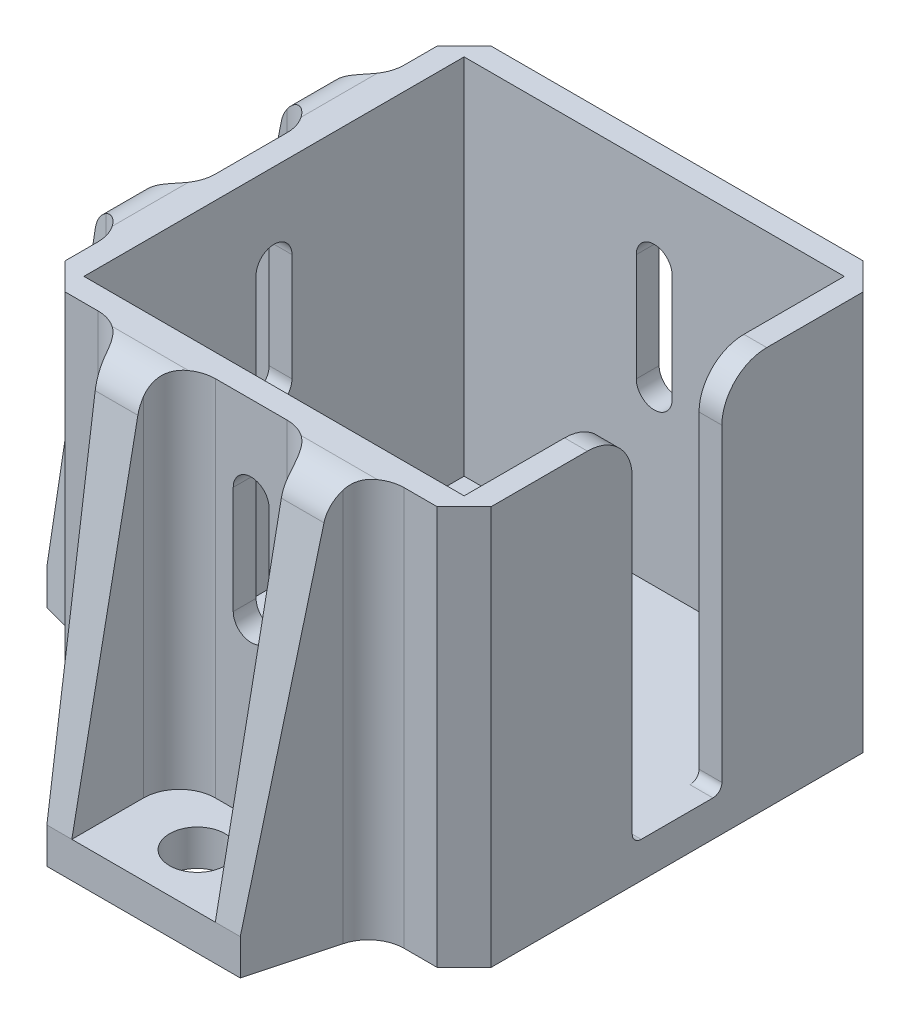
from build123d import *

# Parameters (mm, degrees)
SKETCH1_W                = 47.5
SKETCH1_H                = 47.5
SKETCH1_W_2              = 42.4
SKETCH1_H_2              = 42.4
BOSS_EXTRUDE1_DEPTH      = 40.5
FILLET1_SIZE             = 3
BOSS_EXTRUDE3_DEPTH      = 10
BOSS_EXTRUDE3_DEPTH_BACK = 10
CUT_EXTRUDE1_DEPTH       = 8
CUT_EXTRUDE1_DEPTH_BACK  = 8
BOSS_EXTRUDE4_DEPTH      = 10
BOSS_EXTRUDE4_DEPTH_BACK = 10
CUT_EXTRUDE2_DEPTH       = 8
CUT_EXTRUDE2_DEPTH_BACK  = 8
BOSS_EXTRUDE6_DEPTH      = 4
SKETCH10_R               = 3.1
CUT_EXTRUDE3_DEPTH       = 65.779433465
SKETCH11_R               = 3.1
CUT_EXTRUDE4_DEPTH       = 65.779433465
SKETCH14_W               = 5
SKETCH14_H               = 40.5
CUT_EXTRUDE6_DEPTH       = 10
FILLET9_R                = 5
FILLET10_R               = 1
CUT_EXTRUDE7_DEPTH       = 2.55
CUT_EXTRUDE8_DEPTH       = 72.93443195
CHAMFER1_SIZE            = 4
CHAMFER1_SIZE_2          = 14.92820323
CHAMFER2_SIZE            = 4
CHAMFER2_SIZE_2          = 14.92820323
CHAMFER3_SIZE            = 4
CHAMFER3_SIZE_2          = 14.92820323
FILLET16_R               = 4
FILLET17_R               = 4


with BuildPart() as part:
    # Sketch1 → Boss-Extrude1 (new body)
    with BuildSketch(Plane(origin=(0, 0, 0), x_dir=(1, 0, 0), z_dir=(0, 1, 0))):
        Rectangle(SKETCH1_W, SKETCH1_H)
        Rectangle(SKETCH1_W_2, SKETCH1_H_2, mode=Mode.SUBTRACT)
    extrude(amount=BOSS_EXTRUDE1_DEPTH)

    # Fillet1
    fillet1_edges = [part.edges().sort_by_distance(p)[0] for p in [
        (23.75, 20.25, 23.75),
        (-23.75, 20.25, 23.75),
        (-23.75, 20.25, -23.75),
        (23.75, 20.25, -23.75),
    ]]
    chamfer(fillet1_edges, length=FILLET1_SIZE)

    # Sketch3 → Boss-Extrude3 (add, two sides: drawn at the far end of the back side and taken through both)
    with BuildSketch(Plane.XY.offset(-BOSS_EXTRUDE3_DEPTH_BACK)):
        Polygon((-23.75, 0), (-23.75, 40.5), (-27.75, 40.5), (-35.75, 0), align=None)
    extrude(amount=BOSS_EXTRUDE3_DEPTH + BOSS_EXTRUDE3_DEPTH_BACK)

    # Sketch4 → Cut-Extrude1 (cut, two sides: drawn at the far end of the back side and taken through both)
    with BuildSketch(Plane.XY.offset(-CUT_EXTRUDE1_DEPTH_BACK)):
        Polygon((-35.75, 0), (-23.75, 0), (-23.75, 40.5), (-27.75, 40.5), align=None)
    extrude(amount=CUT_EXTRUDE1_DEPTH + CUT_EXTRUDE1_DEPTH_BACK, mode=Mode.SUBTRACT)

    # Sketch7 → Boss-Extrude4 (add, two sides: drawn at the far end of the back side and taken through both)
    with BuildSketch(Plane(origin=(0, 0, 0), x_dir=(0, 0, -1), z_dir=(1, 0, 0)).offset(-BOSS_EXTRUDE4_DEPTH_BACK)):
        Polygon((-35.75, 0), (-23.75, 0), (-23.75, 40.5), (-27.75, 40.5), align=None)
    extrude(amount=BOSS_EXTRUDE4_DEPTH + BOSS_EXTRUDE4_DEPTH_BACK)

    # Sketch8 → Cut-Extrude2 (cut, two sides: drawn at the far end of the back side and taken through both)
    with BuildSketch(Plane(origin=(0, 0, 0), x_dir=(0, 0, -1), z_dir=(1, 0, 0)).offset(-CUT_EXTRUDE2_DEPTH_BACK)):
        Polygon((-23.75, 0), (-23.75, 40.5), (-27.75, 40.5), (-35.75, 0), align=None)
    extrude(amount=CUT_EXTRUDE2_DEPTH + CUT_EXTRUDE2_DEPTH_BACK, mode=Mode.SUBTRACT)

    # Sketch9 → Boss-Extrude6 (add)
    with BuildSketch(Plane(origin=(0, 0, 0), x_dir=(1, 0, 0), z_dir=(0, 1, 0))):
        Polygon((-35.75, -10), (-23.75, -10), (-23.75, -20.75), (-20.75, -23.75), (-10, -23.75), (-10, -35.75), (10, -35.75), (10, -23.75), (20.75, -23.75), (23.75, -20.75), (23.75, 20.75), (20.75, 23.75), (-20.75, 23.75), (-23.75, 20.75), (-23.75, 10), (-35.75, 10), align=None)
    extrude(amount=-BOSS_EXTRUDE6_DEPTH)

    # Sketch10 → Cut-Extrude3 (cut, through all)
    with BuildSketch(Plane(origin=(0, 0, 0), x_dir=(1, 0, 0), z_dir=(0, 1, 0))):
        with Locations(Location((-29.75, 0, 0), (0, 0, 270))):
            Circle(SKETCH10_R)
    extrude(amount=-CUT_EXTRUDE3_DEPTH, mode=Mode.SUBTRACT)

    # Sketch11 → Cut-Extrude4 (cut, through all)
    with BuildSketch(Plane(origin=(0, 0, 0), x_dir=(1, 0, 0), z_dir=(0, 1, 0))):
        with Locations(Location((0, -29.75, 0), (0, 0, 270))):
            Circle(SKETCH11_R)
    extrude(amount=-CUT_EXTRUDE4_DEPTH, mode=Mode.SUBTRACT)

    # Sketch14 → Cut-Extrude6 (cut)
    with BuildSketch(Plane(origin=(23.75, 0, 0), x_dir=(0, 0, -1), z_dir=(1, 0, 0))):
        with Locations((-2.5, 20.25)):
            Rectangle(SKETCH14_W, SKETCH14_H)
        with Locations((2.5, 20.25)):
            Rectangle(SKETCH14_W, SKETCH14_H)
    extrude(amount=-CUT_EXTRUDE6_DEPTH, mode=Mode.SUBTRACT)

    # Fillet9
    fillet9_edges = [part.edges().sort_by_distance(p)[0] for p in [
        (22.475, 40.5, 5),
        (22.475, 40.5, -5),
    ]]
    fillet(fillet9_edges, radius=FILLET9_R)

    # Fillet10
    fillet10_edges = [part.edges().sort_by_distance(p)[0] for p in [
        (22.475, 0, -5),
        (22.475, 0, 5),
    ]]
    fillet(fillet10_edges, radius=FILLET10_R)

    # Sketch15 → Cut-Extrude7 (cut)
    with BuildSketch(Plane.ZY.offset(23.75)):
        with BuildLine():
            Line((-2, 19), (-2, 31))
            ThreePointArc((-2, 31), (0, 33), (2, 31))
            Line((2, 31), (2, 19))
            ThreePointArc((2, 19), (0, 17), (-2, 19))
        make_face()
    extrude(amount=-CUT_EXTRUDE7_DEPTH, mode=Mode.SUBTRACT)

    # Sketch16 → Cut-Extrude8 (cut, through all)
    with BuildSketch(Plane.XY.offset(23.75)):
        with BuildLine():
            Line((2, 31), (2, 19))
            ThreePointArc((2, 19), (0, 17), (-2, 19))
            Line((-2, 19), (-2, 31))
            ThreePointArc((-2, 31), (0, 33), (2, 31))
        make_face()
    extrude(amount=-CUT_EXTRUDE8_DEPTH, mode=Mode.SUBTRACT)

    # Chamfer1
    # the kernel refuses this chamfer: 14.92820323, 4 mm, written as the material it adds along each edge
    with BuildSketch(Plane(origin=(10, 40.5, 23.75), x_dir=(0.9905000388259542, 0, -0.13751244702129095), z_dir=(0, -1, 0))) as chamfer1_piece_1_section:
        Polygon((CHAMFER1_SIZE * 0.990500038826, CHAMFER1_SIZE * 0.137512447021), (-CHAMFER1_SIZE_2 * 0.137512447024, CHAMFER1_SIZE_2 * 0.990500038844), (0, 0), align=None)
    chamfer1_piece_1 = extrude(amount=44.5, mode=Mode.PRIVATE)
    chamfer1_piece_1 = split(chamfer1_piece_1, bisect_by=Plane(origin=(11.413878062, 16.831768276, 32.425206267), z_dir=(0, -0.19378641821299017, -0.9810437422032618)), keep=Keep.TOP, mode=Mode.PRIVATE)
    chamfer1_piece_1 = split(chamfer1_piece_1, bisect_by=Plane(origin=(11.413878062, 15.820324331, 35.75), z_dir=(0, 0, -1)), keep=Keep.TOP, mode=Mode.PRIVATE)
    add(chamfer1_piece_1)
    with BuildSketch(Plane(origin=(-23.75, 40.5, 10), x_dir=(-0.9999503267608394, 0, -0.009967146577156315), z_dir=(0, -1, 0))) as chamfer1_piece_2_section:
        Polygon((CHAMFER1_SIZE_2 * 0.999950326779, -CHAMFER1_SIZE_2 * 0.00996714657734), (-CHAMFER1_SIZE * 0.00996714657716, -CHAMFER1_SIZE * 0.999950326761), (0, 0), align=None)
    chamfer1_piece_2 = extrude(amount=44.5, mode=Mode.PRIVATE)
    chamfer1_piece_2 = split(chamfer1_piece_2, bisect_by=Plane(origin=(-32.425206267, 16.831768276, 11.413878062), z_dir=(0.9810437422032618, -0.19378641821299017, 0)), keep=Keep.TOP, mode=Mode.PRIVATE)
    chamfer1_piece_2 = split(chamfer1_piece_2, bisect_by=Plane(origin=(-35.75, 15.820324331, 11.413878062), z_dir=(1, 0, 0)), keep=Keep.TOP, mode=Mode.PRIVATE)
    add(chamfer1_piece_2)

    # Chamfer2
    # the kernel refuses this chamfer: 14.92820323, 4 mm, written as the material it adds along each edge
    with BuildSketch(Plane(origin=(-23.75, 40.5, -10), x_dir=(0.13751244702129095, 0, -0.9905000388259542), z_dir=(0, -1, 0))) as chamfer2_piece_1_section:
        Polygon((CHAMFER2_SIZE * 0.990500038826, -CHAMFER2_SIZE * 0.137512447021), (-CHAMFER2_SIZE_2 * 0.137512447024, -CHAMFER2_SIZE_2 * 0.990500038844), (0, 0), align=None)
    chamfer2_piece_1 = extrude(amount=44.5, mode=Mode.PRIVATE)
    chamfer2_piece_1 = split(chamfer2_piece_1, bisect_by=Plane(origin=(-32.425206267, 16.831768276, -11.413878062), z_dir=(0.9810437422032618, -0.19378641821299017, 0)), keep=Keep.TOP, mode=Mode.PRIVATE)
    chamfer2_piece_1 = split(chamfer2_piece_1, bisect_by=Plane(origin=(-35.75, 15.820324331, -11.413878062), z_dir=(1, 0, 0)), keep=Keep.TOP, mode=Mode.PRIVATE)
    add(chamfer2_piece_1)

    # Chamfer3
    # the kernel refuses this chamfer: 14.92820323, 4 mm, written as the material it adds along each edge
    with BuildSketch(Plane(origin=(-10, -4, 23.75), x_dir=(-0.9905000388259542, 0, -0.13751244702129095), z_dir=(0, 1, 0))) as chamfer3_piece_1_section:
        Polygon((CHAMFER3_SIZE * 0.990500038826, CHAMFER3_SIZE * 0.137512447021), (-CHAMFER3_SIZE_2 * 0.137512447024, CHAMFER3_SIZE_2 * 0.990500038844), (0, 0), align=None)
    chamfer3_piece_1 = extrude(amount=44.5, mode=Mode.PRIVATE)
    chamfer3_piece_1 = split(chamfer3_piece_1, bisect_by=Plane(origin=(-11.413878062, 16.831768276, 32.425206267), z_dir=(0, -0.19378641821299017, -0.9810437422032618)), keep=Keep.TOP, mode=Mode.PRIVATE)
    chamfer3_piece_1 = split(chamfer3_piece_1, bisect_by=Plane(origin=(-11.413878062, 15.820324331, 35.75), z_dir=(0, 0, -1)), keep=Keep.TOP, mode=Mode.PRIVATE)
    add(chamfer3_piece_1)

    # Fillet16
    fillet16_edges = [part.edges().sort_by_distance(p)[0] for p in [
        (-8, 20.25, 23.75),
        (8, 20.25, 23.75),
        (-23.75, 18.25, 14),
        (14, 18.25, 23.75),
        (-23.75, 18.25, -14),
        (-14, 18.25, 23.75),
        (-23.75, 20.25, -8),
        (-23.75, 20.25, 8),
    ]]
    fillet(fillet16_edges, radius=FILLET16_R)

    # Fillet17
    fillet17_edges = [part.edges().sort_by_distance(p)[0] for p in [
        (-27.75, 40.5, -10.464101615),
        (-27.75, 40.5, 10.464101615),
        (-10.464101615, 40.5, 27.75),
        (10.464101615, 40.5, 27.75),
    ]]
    fillet(fillet17_edges, radius=FILLET17_R)


solid = part.part
